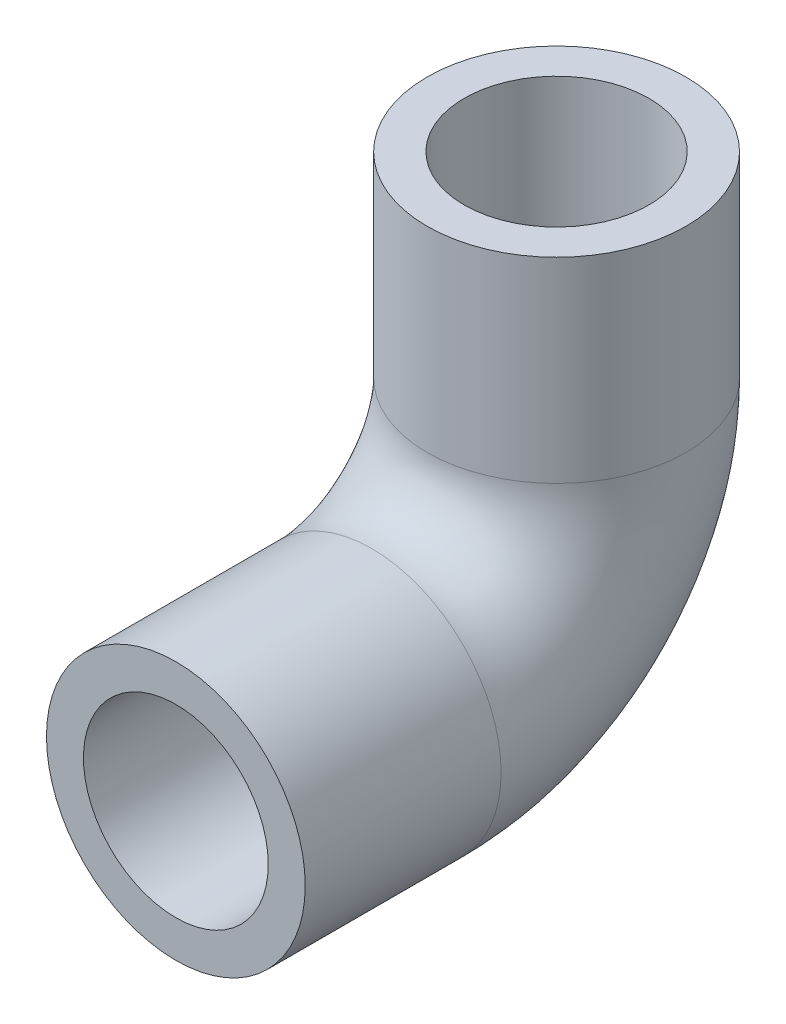
from build123d import *

# Parameters (mm, degrees)
SKETCH1_R           = 8.89
SKETCH1_R_2         = 6.35
BOSS_EXTRUDE1_DEPTH = 13.462
SKETCH3_R           = 8.89
SKETCH3_R_2         = 6.35
SKETCH5_R           = 8.89
SKETCH5_R_2         = 6.349329507
BOSS_EXTRUDE2_DEPTH = 13.462


with BuildPart() as part:
    # Sketch1 → Boss-Extrude1 (new body)
    with BuildSketch(Plane(origin=(0, 0, 0), x_dir=(1, 0, 0), z_dir=(0, 1, 0))):
        Circle(SKETCH1_R)
        Circle(SKETCH1_R_2, mode=Mode.SUBTRACT)
    extrude(amount=BOSS_EXTRUDE1_DEPTH)

    # Sweep1: sweep along a path in Sketch2
    with BuildLine(Plane(origin=(0, 0, 0), x_dir=(0, 0, -1), z_dir=(1, 0, 0))) as sweep1_path:
        ThreePointArc((0, 0), (-3.719743879, -8.980256121), (-12.7, -12.7))
    # Sketch3 → Sweep1 (sweep)
    with BuildSketch(Plane.XZ):
        Circle(SKETCH3_R)
        Circle(SKETCH3_R_2, mode=Mode.SUBTRACT)
    sweep(path=sweep1_path.line)

    # Sketch5 → Boss-Extrude2 (add)
    with BuildSketch(Plane.XY.offset(12.7)):
        with Locations((0, -12.7)):
            Circle(SKETCH5_R)
        with Locations((0, -12.7)):
            Circle(SKETCH5_R_2, mode=Mode.SUBTRACT)
    extrude(amount=BOSS_EXTRUDE2_DEPTH)


solid = part.part
